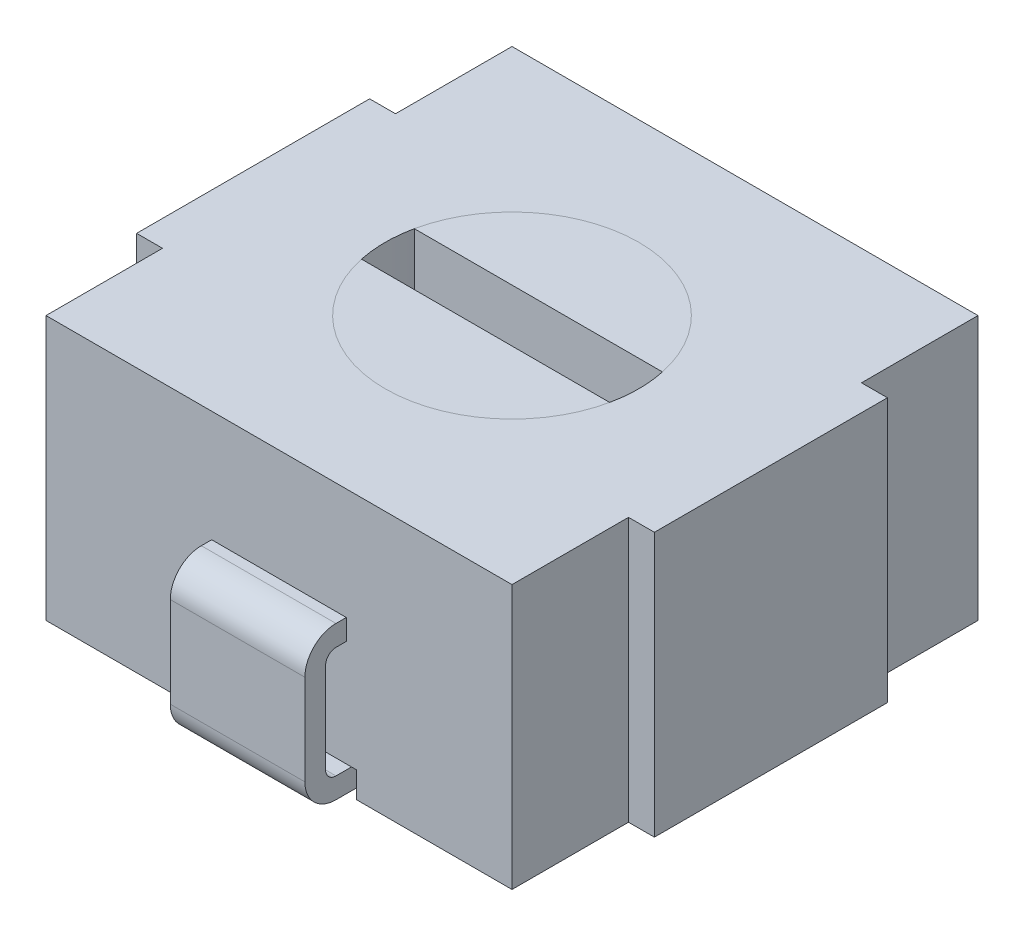
from build123d import *

# Parameters (mm, degrees)
SKETCH1_W                        = 4.5
SKETCH1_H                        = 4.5
BASE_EXTRUDE_DEPTH               = 2.55
SKETCH2_W                        = 0.25
SKETCH2_H                        = 2.25
EARS_EXTRUDE1_DEPTH              = 2.55
SKETCH9_W                        = 3.4
SKETCH9_H                        = 1.4
SKETCH9_W_2                      = 1.5
RELIEF_CUT_BTM_DEPTH             = 0.25
DOUBLE_START                     = -1.6
DOUBLE_FEET_EXTRUDE_THIN1_DEPTH  = 3.2
SINGLE_START                     = -0.65
SINGLE_FOOT_EXTRUDE_THIN2_DEPTH  = 1.3
REMOVE_MIDDLE_OF_FEET_DEPTH      = 0.5
SCREW_DRIVER_SLOT_EXTRUDE2_DEPTH = 0.51


# Read off the part's stored shape, not the designer's step: double feet-Extrude-Thin1, single foot-Extrude-Thin2
with BuildPart() as part:
    # Sketch1 → Base-Extrude (new body)
    with BuildSketch(Plane(origin=(0, 0, 0), x_dir=(1, 0, 0), z_dir=(0, 1, 0))):
        Rectangle(SKETCH1_W, SKETCH1_H)
    extrude(amount=BASE_EXTRUDE_DEPTH)

    # Sketch2 → ears-Extrude1 (add, through all)
    with BuildSketch(Plane(origin=(0, 2.55, 0), x_dir=(-1, 0, 0), z_dir=(0, 1, 0))):
        with Locations((-2.375, 0)):
            Rectangle(SKETCH2_W, SKETCH2_H)
        with Locations((2.375, 0)):
            Rectangle(SKETCH2_W, SKETCH2_H)
    extrude(amount=-EARS_EXTRUDE1_DEPTH)

    # Sketch9 → relief-cut-btm (cut)
    with BuildSketch(Plane.XZ):
        with Locations((0, -1.55)):
            Rectangle(SKETCH9_W, SKETCH9_H)
        with Locations((0, 1.55)):
            Rectangle(SKETCH9_W_2, SKETCH9_H)
    extrude(amount=-RELIEF_CUT_BTM_DEPTH, mode=Mode.SUBTRACT)

    # double feet-Extrude-Thin1 outline → double feet-Extrude-Thin1 (add)
    with BuildSketch(Plane(origin=(0, 0, 0), x_dir=(0, 0, -1), z_dir=(1, 0, 0)).offset(DOUBLE_START)):
        with BuildLine():
            ThreePointArc((2.35, 0), (2.562132034, 0.087867966), (2.65, 0.3))
            Line((2.65, 0.3), (2.65, 1.175))
            ThreePointArc((2.65, 1.175), (2.562132034, 1.387132034), (2.35, 1.475))
            Line((2.35, 1.475), (2.25, 1.475))
            Line((2.25, 1.475), (2.25, 1.275))
            Line((2.25, 1.275), (2.35, 1.275))
            ThreePointArc((2.35, 1.275), (2.420710678, 1.245710678), (2.45, 1.175))
            Line((2.45, 1.175), (2.45, 0.3))
            ThreePointArc((2.45, 0.3), (2.420710678, 0.229289322), (2.35, 0.2))
            Line((2.35, 0.2), (0.95, 0.2))
            Line((0.95, 0.2), (0.95, 0))
            Line((0.95, 0), (2.35, 0))
        make_face()
    extrude(amount=DOUBLE_FEET_EXTRUDE_THIN1_DEPTH)

    # single foot-Extrude-Thin2 outline → single foot-Extrude-Thin2 (add)
    with BuildSketch(Plane(origin=(0, 0, 0), x_dir=(0, 0, -1), z_dir=(1, 0, 0)).offset(SINGLE_START)):
        with BuildLine():
            ThreePointArc((-2.65, 0.3), (-2.562132034, 0.087867966), (-2.35, 0))
            Line((-2.35, 0), (-0.95, 0))
            Line((-0.95, 0), (-0.95, 0.2))
            Line((-0.95, 0.2), (-2.35, 0.2))
            ThreePointArc((-2.35, 0.2), (-2.420710678, 0.229289322), (-2.45, 0.3))
            Line((-2.45, 0.3), (-2.45, 1.175))
            ThreePointArc((-2.45, 1.175), (-2.420710678, 1.245710678), (-2.35, 1.275))
            Line((-2.35, 1.275), (-2.25, 1.275))
            Line((-2.25, 1.275), (-2.25, 1.475))
            Line((-2.25, 1.475), (-2.35, 1.475))
            ThreePointArc((-2.35, 1.475), (-2.562132034, 1.387132034), (-2.65, 1.175))
            Line((-2.65, 1.175), (-2.65, 0.3))
        make_face()
    extrude(amount=SINGLE_FOOT_EXTRUDE_THIN2_DEPTH)

    # Sketch10 → remove-middle-of-feet (cut, symmetric)
    with BuildSketch(Plane(origin=(0, 0, 0), x_dir=(0, 0, -1), z_dir=(1, 0, 0))):
        with BuildLine():
            Line((2.35, 1.475), (2.25, 1.475))
            Line((2.25, 1.475), (2.25, 1.275))
            Line((2.25, 1.275), (2.35, 1.275))
            ThreePointArc((2.35, 1.275), (2.420710678, 1.245710678), (2.45, 1.175))
            Line((2.45, 1.175), (2.45, 0.3))
            ThreePointArc((2.45, 0.3), (2.420710678, 0.229289322), (2.35, 0.2))
            Line((2.35, 0.2), (0.95, 0.2))
            Line((0.95, 0.2), (0.95, 0))
            Line((0.95, 0), (2.35, 0))
            ThreePointArc((2.35, 0), (2.562132034, 0.087867966), (2.65, 0.3))
            Line((2.65, 0.3), (2.65, 1.175))
            ThreePointArc((2.65, 1.175), (2.562132034, 1.387132034), (2.35, 1.475))
        make_face()
    extrude(amount=REMOVE_MIDDLE_OF_FEET_DEPTH, both=True, mode=Mode.SUBTRACT)

    # Sketch7 → screw driver slot-Extrude2 (cut)
    with BuildSketch(Plane(origin=(0, 2.55, 0), x_dir=(-1, 0, 0), z_dir=(0, 1, 0))):
        with BuildLine():
            Line((-1.198165264, 0.255), (1.198165264, 0.255))
            ThreePointArc((1.198165264, 0.255), (1.225, 0), (1.198165264, -0.255))
            Line((1.198165264, -0.255), (-1.198165264, -0.255))
            ThreePointArc((-1.198165264, -0.255), (-1.225, 0), (-1.198165264, 0.255))
        make_face()
    extrude(amount=-SCREW_DRIVER_SLOT_EXTRUDE2_DEPTH, mode=Mode.SUBTRACT)


solid = part.part
